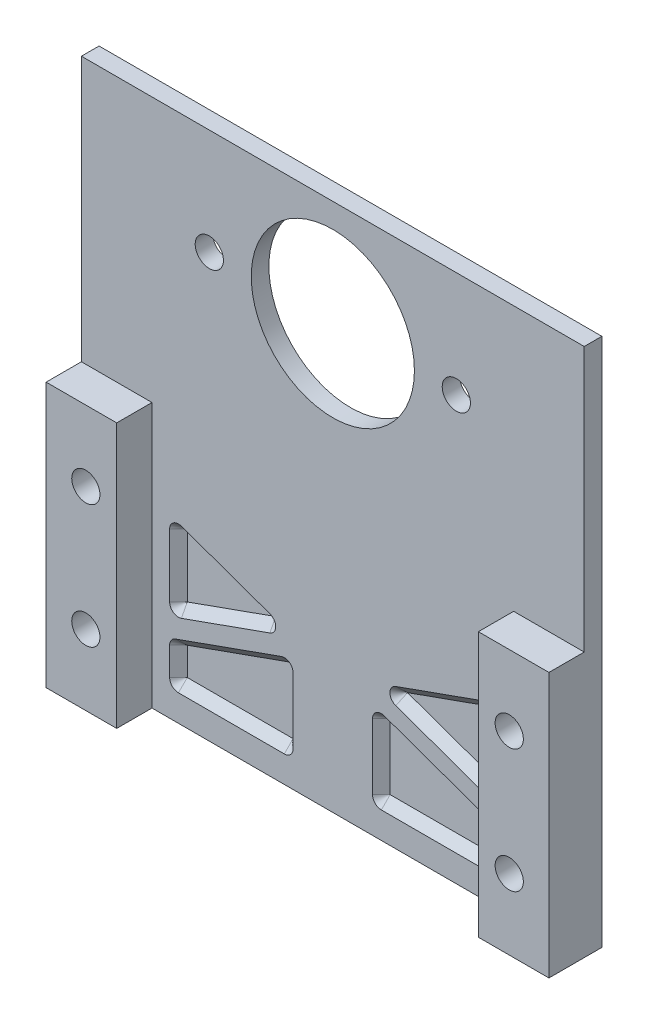
from build123d import *

# Parameters (mm, degrees)
SKIZZE1_W                       = 57
SKIZZE1_H                       = 60
GRUNDPLATTE_DEPTH               = 2
SKIZZE2_R                       = 9.25
SKIZZE2_R_2                     = 1.6
AUSSCHNITT_ROLLE_DEPTH          = 67.454871906
SKIZZE4_W                       = 8
SKIZZE4_H                       = 30
AUFSATZ_GETRIEBE_DEPTH          = 4
BOHRUNGEN_START                 = 4
SKIZZE3_R                       = 1.6
BOHRUNGEN_GETRIEBE_DEPTH        = 71.54509749
SCHNITT_LINEAR_AUSTRAGEN3_DEPTH = 1
VERRUNDUNG1_R                   = 1
FASE1_SIZE                      = 1


with BuildPart() as part:
    # Skizze1 → Grundplatte (new body)
    with BuildSketch(Plane.XY):
        with Locations((0, 30)):
            Rectangle(SKIZZE1_W, SKIZZE1_H)
    extrude(amount=GRUNDPLATTE_DEPTH)

    # Skizze2 → Ausschnitt_Rolle (cut, through all)
    with BuildSketch(Plane.XY.offset(2)):
        with Locations((0, 48)):
            Circle(SKIZZE2_R)
        with Locations((-14, 48)):
            Circle(SKIZZE2_R_2)
        with Locations(Location((14, 48, 0), (0, 0, 180))):
            Circle(SKIZZE2_R_2)
    extrude(amount=-AUSSCHNITT_ROLLE_DEPTH, mode=Mode.SUBTRACT)

    # Skizze4 → Aufsatz Getriebe (add)
    with BuildSketch(Plane.XY.offset(2)):
        with Locations((24.5, 15)):
            Rectangle(SKIZZE4_W, SKIZZE4_H)
        with Locations((-24.5, 15)):
            Rectangle(SKIZZE4_W, SKIZZE4_H)
    extrude(amount=AUFSATZ_GETRIEBE_DEPTH)

    # Skizze3 → Bohrungen Getriebe (cut, through all)
    with BuildSketch(Plane.XY.offset(2).offset(BOHRUNGEN_START)):
        with Locations(Location((-24, 22, 0), (0, 0, 180))):
            Circle(SKIZZE3_R)
        with Locations(Location((-24, 8, 0), (0, 0, 180))):
            Circle(SKIZZE3_R)
        with Locations(Location((24, 8, 0), (0, 0, 180))):
            Circle(SKIZZE3_R)
        with Locations(Location((24, 22, 0), (0, 0, 180))):
            Circle(SKIZZE3_R)
    extrude(amount=-BOHRUNGEN_GETRIEBE_DEPTH, mode=Mode.SUBTRACT)

    # Skizze5 → Schnitt-Linear austragen3 (cut)
    with BuildSketch(Plane.XY.offset(2)):
        Polygon((-18.5, 20), (-18.5, 10), (-4.5, 15), align=None)
        Polygon((-18.5, 7.876275893), (-18.5, 3), (-4.5, 3), (-4.5, 12.876275893), align=None)
        Polygon((4.5, 12.876275893), (18.5, 7.876275893), (18.5, 3), (4.5, 3), align=None)
        Polygon((4.5, 15), (18.5, 20), (18.5, 10), align=None)
    extrude(amount=-SCHNITT_LINEAR_AUSTRAGEN3_DEPTH, mode=Mode.SUBTRACT)

    # Verrundung1
    verrundung1_edges = [part.edges().sort_by_distance(p)[0] for p in [
        (-18.5, 3, 1.5),
        (-4.5, 3, 1.5),
        (-4.5, 12.876275893, 1.5),
        (-18.5, 7.876275893, 1.5),
        (18.5, 20, 1.5),
        (4.5, 15, 1.5),
        (18.5, 10, 1.5),
        (18.5, 3, 1.5),
        (18.5, 7.876275893, 1.5),
        (4.5, 12.876275893, 1.5),
        (4.5, 3, 1.5),
        (-18.5, 10, 1.5),
        (-4.5, 15, 1.5),
        (-18.5, 20, 1.5),
    ]]
    fillet(verrundung1_edges, radius=VERRUNDUNG1_R)

    # Fase1
    fase1_edges = [part.edges().sort_by_distance(p)[0] for p in [
        (4.923951563, 12.274686543, 1),
        (11.836336397, 10.256155751, 1),
        (18.31741556, 7.747605134, 1),
        (18.5, 5.585778349, 1),
        (18.207106781, 3.292893219, 1),
        (11.5, 3, 1),
        (4.792893219, 3.292893219, 1),
        (4.5, 7.728635491, 1),
        (18.076048437, 10.60158935, 1),
        (12.150270478, 12.267760544, 1),
        (6.473213749, 15, 1),
        (12.150270478, 17.732239456, 1),
        (18.076048437, 19.39841065, 1),
        (18.5, 15, 1),
        (-18.207106781, 3.292893219, 1),
        (-18.5, 5.585778349, 1),
        (-18.31741556, 7.747605134, 1),
        (-11.836336397, 10.256155751, 1),
        (-4.923951563, 12.274686543, 1),
        (-4.5, 7.728635491, 1),
        (-4.792893219, 3.292893219, 1),
        (-11.5, 3, 1),
        (-18.076048437, 10.60158935, 1),
        (-18.5, 15, 1),
        (-18.076048437, 19.39841065, 1),
        (-12.150270478, 17.732239456, 1),
        (-6.473213749, 15, 1),
        (-12.150270478, 12.267760544, 1),
    ]]
    chamfer(fase1_edges, length=FASE1_SIZE - 0.0001)  # a hair under: the kernel refuses the full size


solid = part.part
